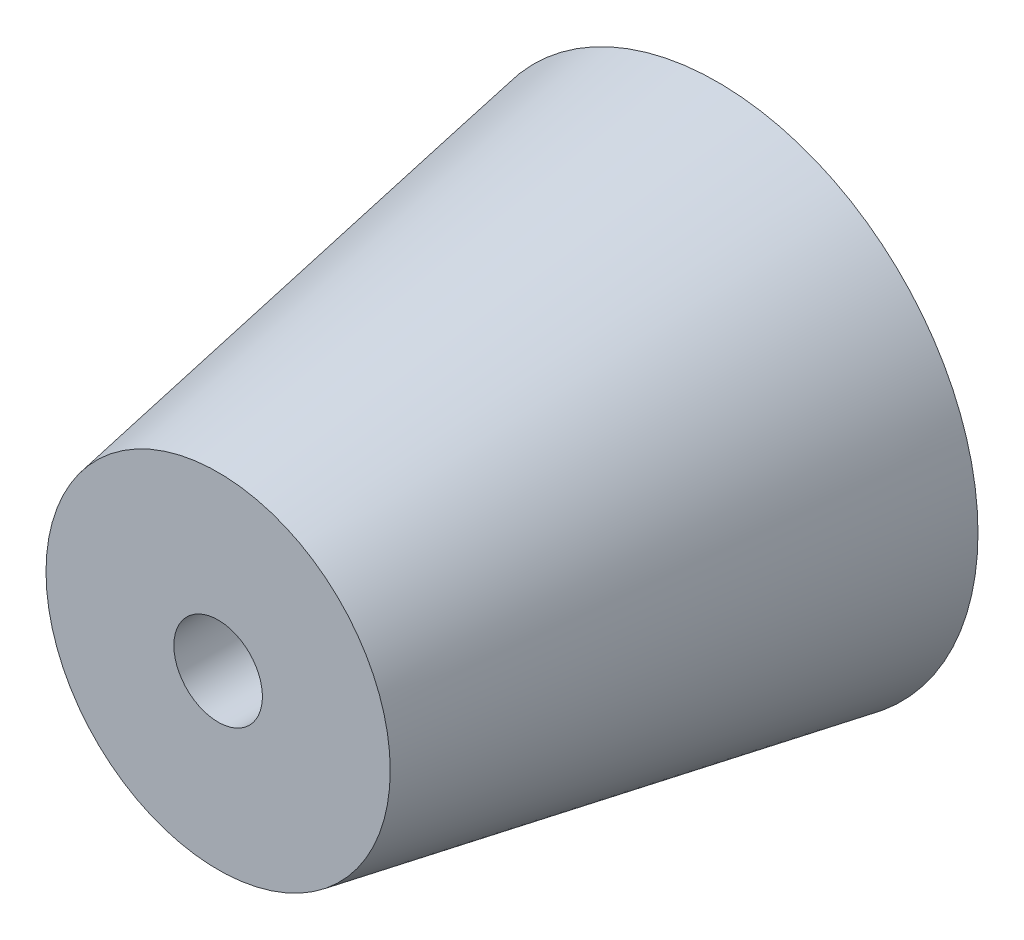
from build123d import *

# Parameters (mm, degrees)
SKETCH1_R          = 17.5
BOSS_EXTRUDE_DEPTH = 50.8
DRAFT3_ANGLE       = 10
SKETCH2_R          = 4.5
CUT_EXTRUDE1_DEPTH = 64.092227361
SKETCH3_R          = 11.5
CUT_EXTRUDE3_DEPTH = 8


with BuildPart() as part:
    # Sketch1 → Boss-Extrude (new body)
    with BuildSketch(Plane.XY):
        Circle(SKETCH1_R)
    extrude(amount=BOSS_EXTRUDE_DEPTH)

    # Draft3
    draft3_faces = [part.faces().sort_by_distance(p)[0] for p in [
        (-17.5, 0, 25.4),
    ]]
    draft(draft3_faces, Plane.XY.offset(50.8), DRAFT3_ANGLE)

    # Sketch2 → Cut-Extrude1 (cut, through all)
    with BuildSketch(Plane(origin=(0, 0, 0), x_dir=(-1, 0, 0), z_dir=(0, 0, -1))):
        Circle(SKETCH2_R)
    extrude(amount=-CUT_EXTRUDE1_DEPTH, mode=Mode.SUBTRACT)

    # Sketch3 → Cut-Extrude3 (cut)
    with BuildSketch(Plane(origin=(0, 0, 0), x_dir=(-1, 0, 0), z_dir=(0, 0, -1))):
        Circle(SKETCH3_R)
    extrude(amount=-CUT_EXTRUDE3_DEPTH, mode=Mode.SUBTRACT)


solid = part.part
